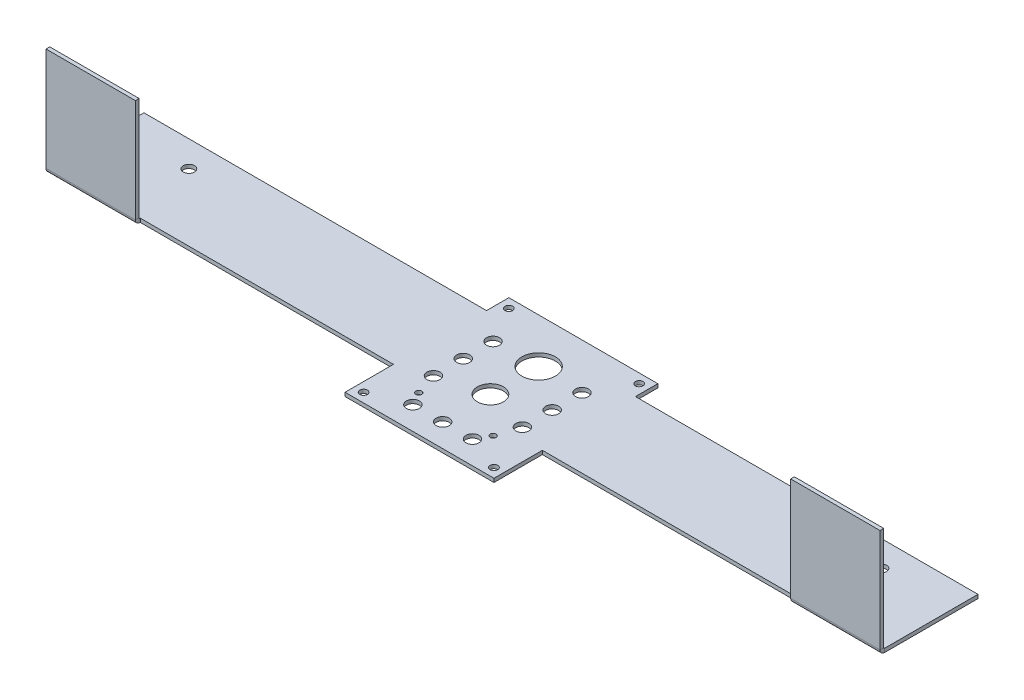
from build123d import *

# Parameters (mm, degrees)
SKETCH18_W                    = 711.2
SKETCH18_H                    = 3.175
BASE_FLANGE1_DEPTH            = 171.45
SKETCH23_W                    = 215.9
SKETCH23_H                    = 88.9
CUT_EXTRUDE1_DEPTH            = 629.760610691
SKETCH24_W                    = 127
SKETCH24_H                    = 31.75
CUT_EXTRUDE2_DEPTH            = 629.760610691
SKETCH25_W                    = 215.9
SKETCH25_H                    = 88.9
CUT_EXTRUDE3_DEPTH            = 629.760610691
SKETCH30_W                    = 215.9
SKETCH30_H                    = 3.175
CUT_EXTRUDE6_DEPTH            = 629.760610691
SKETCH38_W                    = 215.9
SKETCH38_H                    = 3.175
CUT_EXTRUDE8_DEPTH            = 629.760610691
SKETCHED_START                = -106.274614162
SKETCHED_BEND17_OUTLINE_W     = 3.175
SKETCHED_BEND17_OUTLINE_H     = 88.9
SKETCHED_BEND17_OUTLINE_H_2   = 79.375
SKETCHED_BEND17_DEPTH         = 635
SKETCHED_START_2              = 528.725385838
SKETCHED_BEND17_2_DEPTH       = 76.2
SKETCHED_BEND17_3_OUTLINE_W   = 79.375
SKETCHED_BEND17_3_OUTLINE_H   = 3.175
SKETCHED_BEND17_3_DEPTH       = 711.2
SKETCHED_START_3              = 185.825385838
SKETCHED_BEND17_4_OUTLINE_W   = 56.152487743
SKETCHED_BEND17_4_OUTLINE_H   = 3.175
SKETCHED_BEND17_4_OUTLINE_W_2 = 0.997512257
SKETCHED_BEND17_4_DEPTH       = 127
SKETCHED_BEND17_5_OUTLINE_W   = 87.902487743
SKETCHED_BEND17_5_OUTLINE_H   = 3.175
SKETCHED_BEND17_5_OUTLINE_W_2 = 0.997512257
SKETCHED_BEND17_5_DEPTH       = 76.2
SKETCHED_BEND17_6_DEPTH       = 76.2
SKETCHED_BEND18_OUTLINE_W     = 79.375
SKETCHED_BEND18_OUTLINE_H     = 3.175
SKETCHED_BEND18_DEPTH         = 711.2
SKETCHED_BEND18_2_DEPTH       = 127
SKETCHED_BEND18_3_DEPTH       = 76.2
SKETCHED_BEND18_4_DEPTH       = 76.2
SKETCHED_BEND18_5_OUTLINE_W   = 3.175
SKETCHED_BEND18_5_OUTLINE_H   = 79.375
SKETCHED_BEND18_5_DEPTH       = 711.2
SKETCHED_BEND18_6_OUTLINE_W   = 3.175
SKETCHED_BEND18_6_OUTLINE_H   = 56.152487743
SKETCHED_BEND18_6_OUTLINE_H_2 = 0.997512257
SKETCHED_BEND18_6_DEPTH       = 127
SKETCHED_BEND18_7_DEPTH       = 76.2
SKETCHED_BEND18_8_DEPTH       = 76.2
SKETCH46_R                    = 3.2512
SKETCH46_R_2                  = 5.5626
SKETCH46_R_3                  = 2.54
SKETCH46_R_4                  = 11.1125
SKETCH46_R_5                  = 14.2875
CUT_EXTRUDE10_DEPTH           = 630.590276433
SKETCH47_R                    = 4.7625
CUT_EXTRUDE11_DEPTH           = 630.590276433
SKETCH48_W                    = 127
SKETCH48_H                    = 3.175
BOSS_EXTRUDE1_DEPTH           = 19.05
SKETCH49_R                    = 3.2512
CUT_EXTRUDE12_DEPTH           = 630.590276433
SKETCH50_W                    = 127
SKETCH50_H                    = 19.05
CUT_EXTRUDE13_DEPTH           = 630.590276433


# Read off the part's stored shape, not the designer's step: Sketched Bend17, Sketched Bend18
# Sheet-metal steps are written as plain solids
with BuildPart() as part:
    # Sketch18 → Base-Flange1 (new body)
    with BuildSketch(Plane.XY):
        with Locations((249.325385838, -1.5875)):
            Rectangle(SKETCH18_W, SKETCH18_H)
    extrude(amount=BASE_FLANGE1_DEPTH)

    # Sketch23 → Cut-Extrude1 (cut, through all)
    with BuildSketch(Plane(origin=(0, 0, 0), x_dir=(1, 0, 0), z_dir=(0, 1, 0))):
        with Locations((77.875385838, -44.45)):
            Rectangle(SKETCH23_W, SKETCH23_H)
    extrude(amount=-CUT_EXTRUDE1_DEPTH, mode=Mode.SUBTRACT)

    # Sketch24 → Cut-Extrude2 (cut, through all)
    with BuildSketch(Plane(origin=(0, 0, 0), x_dir=(1, 0, 0), z_dir=(0, 1, 0))):
        with Locations((249.325385838, -15.875)):
            Rectangle(SKETCH24_W, SKETCH24_H)
    extrude(amount=-CUT_EXTRUDE2_DEPTH, mode=Mode.SUBTRACT)

    # Sketch25 → Cut-Extrude3 (cut, through all)
    with BuildSketch(Plane(origin=(0, 0, 0), x_dir=(1, 0, 0), z_dir=(0, 1, 0))):
        with Locations((420.775385838, -44.45)):
            Rectangle(SKETCH25_W, SKETCH25_H)
    extrude(amount=-CUT_EXTRUDE3_DEPTH, mode=Mode.SUBTRACT)

    # Sketch30 → Cut-Extrude6 (cut, through all)
    with BuildSketch(Plane(origin=(0, 0, 0), x_dir=(1, 0, 0), z_dir=(0, 1, 0))):
        with Locations((77.875385838, -90.4875)):
            Rectangle(SKETCH30_W, SKETCH30_H)
    extrude(amount=-CUT_EXTRUDE6_DEPTH, mode=Mode.SUBTRACT)

    # Sketch38 → Cut-Extrude8 (cut, through all)
    with BuildSketch(Plane(origin=(0, -3.175, 0), x_dir=(-1, 0, 0), z_dir=(0, -1, 0))):
        with Locations((-420.775385838, -90.4875)):
            Rectangle(SKETCH38_W, SKETCH38_H)
    extrude(amount=-CUT_EXTRUDE8_DEPTH, mode=Mode.SUBTRACT)

    # Sketched Bend17 outline → Sketched Bend17 (cut)
    with BuildSketch(Plane.YZ.offset(SKETCHED_START)):
        with Locations((-1.5875, 44.45)):
            Rectangle(SKETCHED_BEND17_OUTLINE_W, SKETCHED_BEND17_OUTLINE_H)
        with Locations((-1.5875, 131.7625)):
            Rectangle(SKETCHED_BEND17_OUTLINE_W, SKETCHED_BEND17_OUTLINE_H_2)
    extrude(amount=SKETCHED_BEND17_DEPTH, mode=Mode.SUBTRACT)

    # Sketched Bend17 2 outline → Sketched Bend17 2 (cut)
    with BuildSketch(Plane.YZ.offset(SKETCHED_START_2)):
        with BuildLine():
            Line((0, 88.1634), (0, 171.45))
            Line((0, 171.45), (-3.175, 171.45))
            Line((-3.175, 171.45), (-3.175, 92.005018799))
            ThreePointArc((-3.175, 92.005018799), (-0.896479843, 90.655319942), (0, 88.1634))
        make_face()
    extrude(amount=SKETCHED_BEND17_2_DEPTH, mode=Mode.SUBTRACT)



with BuildPart() as body_2:
    # Sketched Bend17 3 outline → Sketched Bend17 3 (new body)
    with BuildSketch(Plane.YZ.offset(SKETCHED_START)):
        with Locations((-43.860012257, 90.4875)):
            Rectangle(SKETCHED_BEND17_3_OUTLINE_W, SKETCHED_BEND17_3_OUTLINE_H)
    extrude(amount=SKETCHED_BEND17_3_DEPTH)


with BuildPart() as part_1:
    add(part.part)

    add(body_2.part)  # Sketched Bend17 4 merges body 2
    # Sketched Bend17 4 outline → Sketched Bend17 4 (add)
    with BuildSketch(Plane.YZ.offset(SKETCHED_START_3)):
        with Locations((28.076243872, 90.4875)):
            Rectangle(SKETCHED_BEND17_4_OUTLINE_W, SKETCHED_BEND17_4_OUTLINE_H)
        with Locations((-3.673756128, 90.4875)):
            Rectangle(SKETCHED_BEND17_4_OUTLINE_W_2, SKETCHED_BEND17_4_OUTLINE_H)
    extrude(amount=SKETCHED_BEND17_4_DEPTH)

    # Sketched Bend17 5 outline → Sketched Bend17 5 (add)
    with BuildSketch(Plane.YZ.offset(SKETCHED_START)):
        with Locations((43.951243872, 90.4875)):
            Rectangle(SKETCHED_BEND17_5_OUTLINE_W, SKETCHED_BEND17_5_OUTLINE_H)
        with Locations((-3.673756128, 90.4875)):
            Rectangle(SKETCHED_BEND17_5_OUTLINE_W_2, SKETCHED_BEND17_5_OUTLINE_H)
    extrude(amount=SKETCHED_BEND17_5_DEPTH)

    # Sketched Bend17 6 outline → Sketched Bend17 6 (add)
    with BuildSketch(Plane.YZ.offset(SKETCHED_START_2)):
        with BuildLine():
            Line((-3.175, 88.1634), (-3.175, 92.005018799))
            ThreePointArc((-3.175, 92.005018799), (-3.541641581, 92.057465398), (-3.9116, 92.075))
            Line((-3.9116, 92.075), (-4.172512257, 92.075))
            Line((-4.172512257, 92.075), (-4.172512257, 88.9))
            Line((-4.172512257, 88.9), (-3.9116, 88.9))
            ThreePointArc((-3.9116, 88.9), (-3.390745145, 88.684254855), (-3.175, 88.1634))
        make_face()
    extrude(amount=SKETCHED_BEND17_6_DEPTH)

    # Sketched Bend18 outline → Sketched Bend18 (cut)
    with BuildSketch(Plane.YZ.offset(SKETCHED_START)):
        with Locations((-43.860012257, 90.4875)):
            Rectangle(SKETCHED_BEND18_OUTLINE_W, SKETCHED_BEND18_OUTLINE_H)
        with BuildLine():
            Line((-0.260912257, 92.075), (-0.997512257, 92.075))
            Line((-0.997512257, 92.075), (-0.997512257, 92.005018799))
            ThreePointArc((-0.997512257, 92.005018799), (-0.630870676, 92.057465398), (-0.260912257, 92.075))
        make_face()
        with BuildLine():
            ThreePointArc((0, 88.1634), (-0.017534602, 88.533358419), (-0.069981201, 88.9))
            Line((-0.069981201, 88.9), (-0.260912257, 88.9))
            ThreePointArc((-0.260912257, 88.9), (-0.781767112, 88.684254855), (-0.997512257, 88.1634))
            Line((-0.997512257, 88.1634), (-0.997512257, 8.527487743))
            Line((-0.997512257, 8.527487743), (-3.175, 8.527487743))
            Line((-3.175, 8.527487743), (-3.175, 0))
            Line((-3.175, 0), (0, 0))
            Line((0, 0), (0, 88.1634))
        make_face()
    extrude(amount=SKETCHED_BEND18_DEPTH, mode=Mode.SUBTRACT)

    # Sketched Bend18 2 outline → Sketched Bend18 2 (cut)
    with BuildSketch(Plane.YZ.offset(SKETCHED_START_3)):
        with BuildLine():
            ThreePointArc((-0.260912257, 92.075), (-0.630870676, 92.057465398), (-0.997512257, 92.005018799))
            Line((-0.997512257, 92.005018799), (-0.997512257, 88.9))
            Line((-0.997512257, 88.9), (56.152487743, 88.9))
            Line((56.152487743, 88.9), (56.152487743, 92.075))
            Line((56.152487743, 92.075), (-0.260912257, 92.075))
        make_face()
    extrude(amount=SKETCHED_BEND18_2_DEPTH, mode=Mode.SUBTRACT)

    # Sketched Bend18 3 outline → Sketched Bend18 3 (cut)
    with BuildSketch(Plane.YZ.offset(SKETCHED_START)):
        with BuildLine():
            Line((-4.172512257, 92.075), (-4.172512257, 88.9))
            Line((-4.172512257, 88.9), (-4.102531056, 88.9))
            ThreePointArc((-4.102531056, 88.9), (-3.026831142, 90.929318885), (-0.997512257, 92.005018799))
            Line((-0.997512257, 92.005018799), (-0.997512257, 92.075))
            Line((-0.997512257, 92.075), (-4.172512257, 92.075))
        make_face()
    extrude(amount=SKETCHED_BEND18_3_DEPTH, mode=Mode.SUBTRACT)

    # Sketched Bend18 4 outline → Sketched Bend18 4 (cut)
    with BuildSketch(Plane.YZ.offset(SKETCHED_START_2)):
        with BuildLine():
            Line((-3.9116, 92.075), (-4.172512257, 92.075))
            Line((-4.172512257, 92.075), (-4.172512257, 88.9))
            Line((-4.172512257, 88.9), (-4.102531056, 88.9))
            ThreePointArc((-4.102531056, 88.9), (-3.404521564, 90.491131747), (-2.086256128, 91.622985858))
            ThreePointArc((-2.086256128, 91.622985858), (-2.971361063, 91.960315235), (-3.9116, 92.075))
        make_face()
    extrude(amount=SKETCHED_BEND18_4_DEPTH, mode=Mode.SUBTRACT)

    # Sketched Bend18 5 outline → Sketched Bend18 5 (add)
    with BuildSketch(Plane.YZ.offset(SKETCHED_START)):
        with Locations((-2.585012257, 48.214987743)):
            Rectangle(SKETCHED_BEND18_5_OUTLINE_W, SKETCHED_BEND18_5_OUTLINE_H)
    extrude(amount=SKETCHED_BEND18_5_DEPTH)

    # Sketched Bend18 6 outline → Sketched Bend18 6 (add)
    with BuildSketch(Plane.YZ.offset(SKETCHED_START_3)):
        with Locations((-2.585012257, 120.151243872)):
            Rectangle(SKETCHED_BEND18_6_OUTLINE_W, SKETCHED_BEND18_6_OUTLINE_H)
        with Locations((-2.585012257, 88.401243872)):
            Rectangle(SKETCHED_BEND18_6_OUTLINE_W, SKETCHED_BEND18_6_OUTLINE_H_2)
    extrude(amount=SKETCHED_BEND18_6_DEPTH)

    # Sketched Bend18 7 outline → Sketched Bend18 7 (add)
    with BuildSketch(Plane.YZ.offset(SKETCHED_START_2)):
        with BuildLine():
            ThreePointArc((-4.102531056, 88.9), (-4.154977655, 88.533358419), (-4.172512257, 88.1634))
            Line((-4.172512257, 88.1634), (-4.172512257, 87.902487743))
            Line((-4.172512257, 87.902487743), (-3.175, 87.902487743))
            Line((-3.175, 87.902487743), (-3.175, 88.1634))
            ThreePointArc((-3.175, 88.1634), (-3.390745145, 88.684254855), (-3.9116, 88.9))
            Line((-3.9116, 88.9), (-4.102531056, 88.9))
        make_face()
        with BuildLine():
            ThreePointArc((-2.086256128, 91.622985858), (-0.767990693, 90.491131747), (-0.069981201, 88.9))
            Line((-0.069981201, 88.9), (87.902487743, 88.9))
            Line((87.902487743, 88.9), (87.902487743, 92.075))
            Line((87.902487743, 92.075), (-0.260912257, 92.075))
            ThreePointArc((-0.260912257, 92.075), (-1.201151194, 91.960315235), (-2.086256128, 91.622985858))
        make_face()
    extrude(amount=SKETCHED_BEND18_7_DEPTH)

    # Sketched Bend18 8 outline → Sketched Bend18 8 (add)
    with BuildSketch(Plane.YZ.offset(SKETCHED_START)):
        with BuildLine():
            ThreePointArc((-4.102531056, 88.9), (-4.154977655, 88.533358419), (-4.172512257, 88.1634))
            Line((-4.172512257, 88.1634), (-4.172512257, 87.902487743))
            Line((-4.172512257, 87.902487743), (-0.997512257, 87.902487743))
            Line((-0.997512257, 87.902487743), (-0.997512257, 88.1634))
            ThreePointArc((-0.997512257, 88.1634), (-0.781767112, 88.684254855), (-0.260912257, 88.9))
            Line((-0.260912257, 88.9), (-4.102531056, 88.9))
        make_face()
    extrude(amount=SKETCHED_BEND18_8_DEPTH)

    # Sketch46 → Cut-Extrude10 (cut, through all)
    with BuildSketch(Plane.XZ.offset(4.172512257)):
        with Locations(Location((193.750185838, 121.252687743, 0), (0, 0, 270))):
            Circle(SKETCH46_R)
        with Locations(Location((223.925385838, 109.416287743, 0), (0, 0, 270))):
            Circle(SKETCH46_R_2)
        with Locations(Location((217.575385838, 98.157737743, 0), (0, 0, 270))):
            Circle(SKETCH46_R_3)
        with Locations(Location((249.325385838, 109.416287743, 0), (0, 0, 270))):
            Circle(SKETCH46_R_2)
        with Locations(Location((274.725385838, 109.416287743, 0), (0, 0, 270))):
            Circle(SKETCH46_R_2)
        with Locations(Location((304.900585838, 121.252687743, 0), (0, 0, 270))):
            Circle(SKETCH46_R)
        with Locations(Location((281.075385838, 98.157737743, 0), (0, 0, 270))):
            Circle(SKETCH46_R_3)
        with Locations(Location((211.4101641, 79.354666332, 0), (0, 0, 270))):
            Circle(SKETCH46_R_2)
        with Locations(Location((249.325385838, 68.725487743, 0), (0, 0, 270))):
            Circle(SKETCH46_R_4)
        with Locations(Location((287.240607577, 79.354666332, 0), (0, 0, 270))):
            Circle(SKETCH46_R_2)
        with Locations(Location((211.4101641, 53.954666332, 0), (0, 0, 270))):
            Circle(SKETCH46_R_2)
        with Locations(Location((287.240607577, 53.954666332, 0), (0, 0, 270))):
            Circle(SKETCH46_R_2)
        with Locations(Location((211.4101641, 28.554666332, 0), (0, 0, 270))):
            Circle(SKETCH46_R_2)
        with Locations(Location((249.325385838, 27.577487743, 0), (0, 0, 270))):
            Circle(SKETCH46_R_5)
        with Locations(Location((287.240607577, 28.554666332, 0), (0, 0, 270))):
            Circle(SKETCH46_R_2)
    extrude(amount=-CUT_EXTRUDE10_DEPTH, mode=Mode.SUBTRACT)

    # Sketch47 → Cut-Extrude11 (cut, through all)
    with BuildSketch(Plane.XZ.offset(4.172512257)):
        with Locations(Location((-45.748954162, 30.752487743, 0), (0, 0, 270))):
            Circle(SKETCH47_R)
        with Locations(Location((544.399725838, 30.752487743, 0), (0, 0, 270))):
            Circle(SKETCH47_R)
    extrude(amount=-CUT_EXTRUDE11_DEPTH, mode=Mode.SUBTRACT)

    # Sketch48 → Boss-Extrude1 (add)
    with BuildSketch(Plane(origin=(0, 0, 8.527487743), x_dir=(-1, 0, 0), z_dir=(0, 0, -1))):
        with Locations((-249.325385838, -2.585012257)):
            Rectangle(SKETCH48_W, SKETCH48_H)
    extrude(amount=BOSS_EXTRUDE1_DEPTH)

    # Sketch49 → Cut-Extrude12 (cut, through all)
    with BuildSketch(Plane(origin=(0, -4.172512257, 0), x_dir=(-1, 0, 0), z_dir=(0, -1, 0))):
        with Locations(Location((-193.750185838, 2.597712257, 0), (0, 0, 90))):
            Circle(SKETCH49_R)
        with Locations(Location((-304.900585838, 2.597712257, 0), (0, 0, 90))):
            Circle(SKETCH49_R)
    extrude(amount=-CUT_EXTRUDE12_DEPTH, mode=Mode.SUBTRACT)

    # Sketch50 → Cut-Extrude13 (cut, through all)
    with BuildSketch(Plane(origin=(0, -4.172512257, 0), x_dir=(-1, 0, 0), z_dir=(0, -1, 0))):
        with Locations((-249.325385838, -138.702487743)):
            Rectangle(SKETCH50_W, SKETCH50_H)
    extrude(amount=-CUT_EXTRUDE13_DEPTH, mode=Mode.SUBTRACT)


solid = part_1.part
